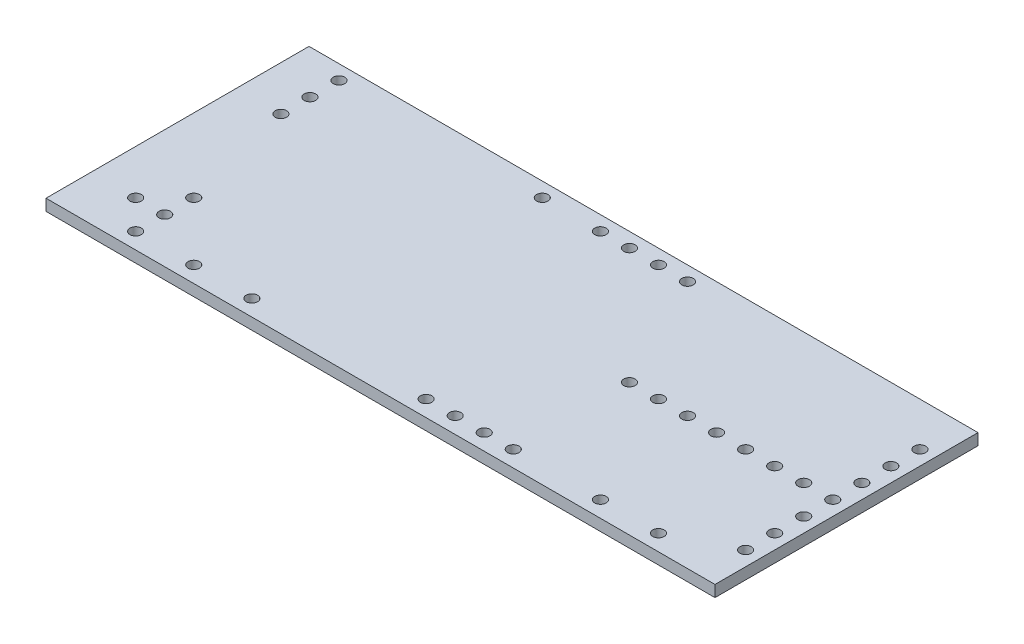
from build123d import *

# Parameters (mm, degrees)
SKETCH1_W           = 58.5
SKETCH1_H           = 23
BOSS_EXTRUDE1_DEPTH = 1
SKETCH2_R           = 0.5
CUT_EXTRUDE1_DEPTH  = 63.86692294


with BuildPart() as part:
    # Sketch1 → Boss-Extrude1 (new body)
    with BuildSketch(Plane(origin=(0, 0, 0), x_dir=(1, 0, 0), z_dir=(0, 1, 0))):
        with Locations((29.25, -11.5)):
            Rectangle(SKETCH1_W, SKETCH1_H)
    extrude(amount=BOSS_EXTRUDE1_DEPTH)

    # Sketch2 → Cut-Extrude1 (cut, through all)
    with BuildSketch(Plane(origin=(0, 1, 0), x_dir=(1, 0, 0), z_dir=(0, 1, 0))):
        with Locations((57.23, -3.81)):
            Circle(SKETCH2_R)
        with Locations((57.23, -6.35)):
            Circle(SKETCH2_R)
        with Locations((57.23, -8.89)):
            Circle(SKETCH2_R)
        with Locations((57.23, -11.43)):
            Circle(SKETCH2_R)
        with Locations((57.23, -13.97)):
            Circle(SKETCH2_R)
        with Locations((57.23, -16.51)):
            Circle(SKETCH2_R)
        with Locations((57.23, -19.05)):
            Circle(SKETCH2_R)
        with Locations((54.69, -11.43)):
            Circle(SKETCH2_R)
        with Locations((52.15, -11.43)):
            Circle(SKETCH2_R)
        with Locations((49.61, -11.43)):
            Circle(SKETCH2_R)
        with Locations((47.07, -11.43)):
            Circle(SKETCH2_R)
        with Locations((44.53, -11.43)):
            Circle(SKETCH2_R)
        with Locations((41.99, -11.43)):
            Circle(SKETCH2_R)
        with Locations((39.45, -11.43)):
            Circle(SKETCH2_R)
        with Locations((39.45, -21.59)):
            Circle(SKETCH2_R)
        with Locations((36.91, -21.59)):
            Circle(SKETCH2_R)
        with Locations((34.37, -21.59)):
            Circle(SKETCH2_R)
        with Locations((31.83, -21.59)):
            Circle(SKETCH2_R)
        with Locations((16.59, -21.59)):
            Circle(SKETCH2_R)
        with Locations((11.51, -21.59)):
            Circle(SKETCH2_R)
        with Locations((6.43, -21.59)):
            Circle(SKETCH2_R)
        with Locations((47.07, -21.59)):
            Circle(SKETCH2_R)
        with Locations((52.15, -21.59)):
            Circle(SKETCH2_R)
        with Locations((6.43, -19.05)):
            Circle(SKETCH2_R)
        with Locations((6.43, -16.51)):
            Circle(SKETCH2_R)
        with Locations((3.89, -19.05)):
            Circle(SKETCH2_R)
        with Locations((3.89, -6.35)):
            Circle(SKETCH2_R)
        with Locations((3.89, -3.81)):
            Circle(SKETCH2_R)
        with Locations((3.89, -1.27)):
            Circle(SKETCH2_R)
        with Locations((21.67, -1.27)):
            Circle(SKETCH2_R)
        with Locations((26.75, -1.27)):
            Circle(SKETCH2_R)
        with Locations((29.29, -1.27)):
            Circle(SKETCH2_R)
        with Locations((31.83, -1.27)):
            Circle(SKETCH2_R)
        with Locations((34.37, -1.27)):
            Circle(SKETCH2_R)
    extrude(amount=-CUT_EXTRUDE1_DEPTH, mode=Mode.SUBTRACT)


solid = part.part
